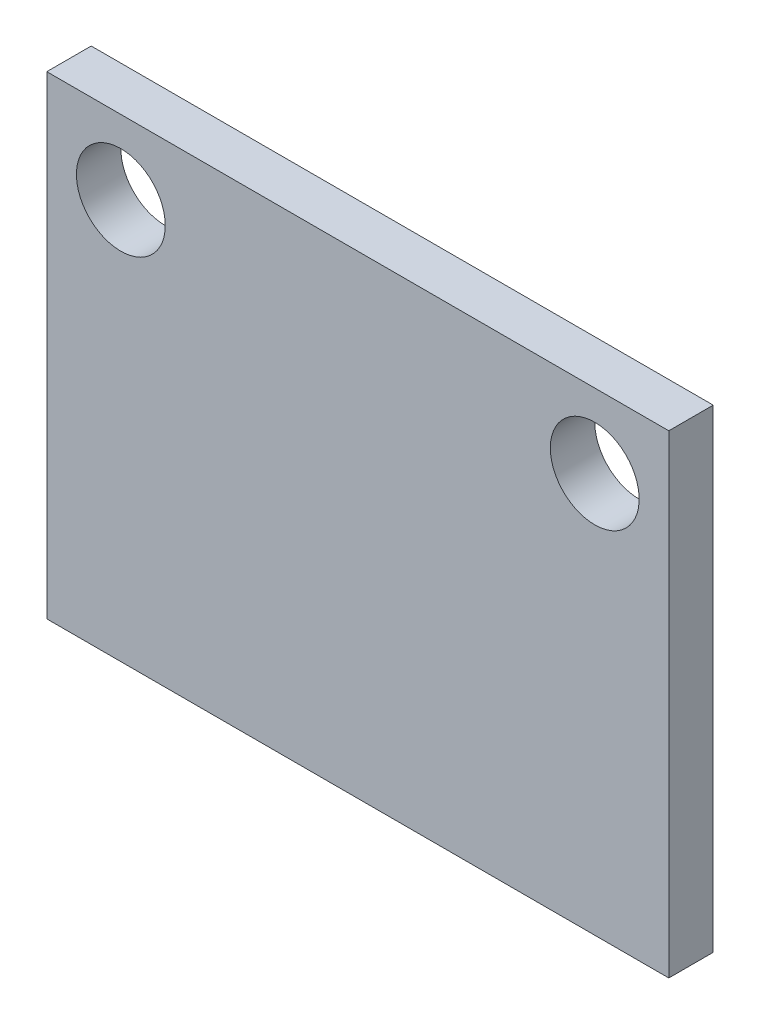
from build123d import *

# Parameters (mm, degrees)
CROQUIS1_W              = 21
CROQUIS1_H              = 16
CROQUIS1_R              = 1.5
SALIENTE_EXTRUIR1_DEPTH = 1.5


with BuildPart() as part:
    # Croquis1 → Saliente-Extruir1 (new body)
    with BuildSketch(Plane.XY):
        Rectangle(CROQUIS1_W, CROQUIS1_H)
        with Locations((-8, 5.5)):
            Circle(CROQUIS1_R, mode=Mode.SUBTRACT)
        with Locations((8, 5.5)):
            Circle(CROQUIS1_R, mode=Mode.SUBTRACT)
    extrude(amount=SALIENTE_EXTRUIR1_DEPTH)


solid = part.part
